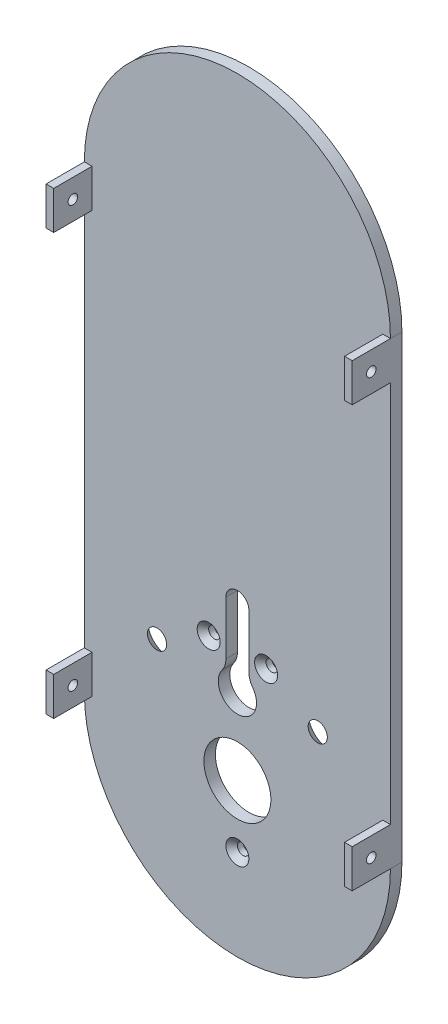
from build123d import *

# Parameters (mm, degrees)
SKETCH3_R           = 40
BOSS_EXTRUDE4_DEPTH = 3
SKETCH6_R           = 1.5
SKETCH6_R_2         = 8.75
CUT_EXTRUDE2_DEPTH  = 165.951508026
CHAMFER1_SIZE       = 1.5
SKETCH12_W          = 2
SKETCH12_H          = 10
BOSS_EXTRUDE7_DEPTH = 10
SKETCH13_R          = 1.25
CUT_EXTRUDE8_DEPTH  = 180.357185527
SKETCH14_R          = 2.5
CUT_EXTRUDE9_DEPTH  = 166.435788148
CHAMFER2_SIZE       = 3
CUT_EXTRUDE10_DEPTH = 166.435788148
FILLET1_R           = 5


with BuildPart() as part:
    # Sketch3 → Boss-Extrude4 (new body)
    with BuildSketch(Plane.XY):
        with BuildLine():
            ThreePointArc((40, 0), (0, 40), (-40, 0))
            Line((-40, 0), (40, 0))
        make_face()
        with BuildLine():
            Line((40, 0), (-40, 0))
            ThreePointArc((-40, 0), (0, -40), (40, 0))
        make_face()
        with BuildLine():
            Line((-40, 120), (-40, 0))
            ThreePointArc((-40, 0), (0, 40), (40, 0))
            Line((40, 0), (40, 120))
            ThreePointArc((40, 120), (0, 80), (-40, 120))
        make_face()
        with Locations((0, 120)):
            Circle(SKETCH3_R)
    extrude(amount=BOSS_EXTRUDE4_DEPTH)

    # Sketch6 → Cut-Extrude2 (cut, through all)
    with BuildSketch(Plane(origin=(0, 0, 0), x_dir=(-1, 0, 0), z_dir=(0, 0, -1))):
        with Locations((-7.5, 29.007101127)):
            Circle(SKETCH6_R)
        with Locations((7.5, 29.007101127)):
            Circle(SKETCH6_R)
        with Locations((0, -16.25)):
            Circle(SKETCH6_R)
        Circle(SKETCH6_R_2)
    extrude(amount=-CUT_EXTRUDE2_DEPTH, mode=Mode.SUBTRACT)

    # Chamfer1
    chamfer1_edges = [part.edges().sort_by_distance(p)[0] for p in [
        (-6, 29.007101127, 3),
        (1.5, -16.25, 3),
        (9, 29.007101127, 3),
    ]]
    chamfer(chamfer1_edges, length=CHAMFER1_SIZE)

    # Sketch12 → Boss-Extrude7 (add)
    with BuildSketch(Plane.XY.offset(3)):
        with Locations((39, 115)):
            Rectangle(SKETCH12_W, SKETCH12_H)
        with Locations((-39, 115)):
            Rectangle(SKETCH12_W, SKETCH12_H)
        with Locations((-39, 5)):
            Rectangle(SKETCH12_W, SKETCH12_H)
        with Locations((39, 5)):
            Rectangle(SKETCH12_W, SKETCH12_H)
    extrude(amount=BOSS_EXTRUDE7_DEPTH)

    # Sketch13 → Cut-Extrude8 (cut, through all)
    with BuildSketch(Plane.ZY.offset(40)):
        with Locations((8, 115)):
            Circle(SKETCH13_R)
        with Locations((8, 5)):
            Circle(SKETCH13_R)
    extrude(amount=-CUT_EXTRUDE8_DEPTH, mode=Mode.SUBTRACT)

    # Sketch14 → Cut-Extrude9 (cut, through all)
    with BuildSketch(Plane(origin=(0, 0, 0), x_dir=(-1, 0, 0), z_dir=(0, 0, -1))):
        with Locations((-21, 21.5)):
            Circle(SKETCH14_R)
        with Locations((21, 21.5)):
            Circle(SKETCH14_R)
    extrude(amount=-CUT_EXTRUDE9_DEPTH, mode=Mode.SUBTRACT)

    # Chamfer2
    chamfer2_edges = [part.edges().sort_by_distance(p)[0] for p in [
        (23.5, 21.5, 0),
        (-18.5, 21.5, 0),
    ]]
    chamfer(chamfer2_edges, length=CHAMFER2_SIZE - 0.0001)  # a hair under: the kernel refuses the full size

    # Sketch9 → Cut-Extrude10 (cut, through all)
    with BuildSketch(Plane(origin=(0, 0, 0), x_dir=(-1, 0, 0), z_dir=(0, 0, -1))):
        with BuildLine():
            ThreePointArc((3, 40), (0, 43), (-3, 40))
            Line((-3, 40), (-3, 24))
            ThreePointArc((-3, 24), (0, 15), (3, 24))
            Line((3, 24), (3, 40))
        make_face()
    extrude(amount=-CUT_EXTRUDE10_DEPTH, mode=Mode.SUBTRACT)

    # Fillet1
    fillet1_edges = [part.edges().sort_by_distance(p)[0] for p in [
        (3, 24, 1.5),
        (-3, 24, 1.5),
    ]]
    fillet(fillet1_edges, radius=FILLET1_R)


solid = part.part
